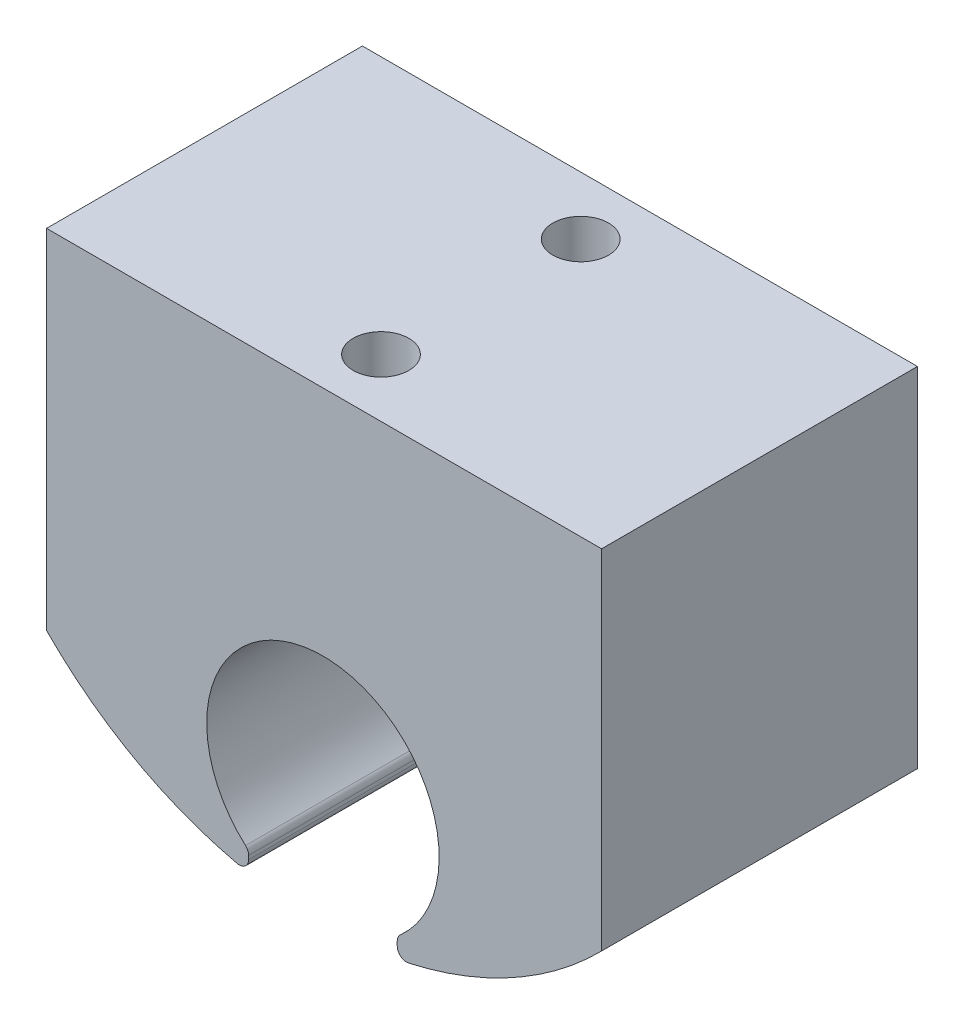
from build123d import *

# Parameters (mm, degrees)
BOSS_EXTRUDE1_START = -8.5
BOSS_EXTRUDE1_DEPTH = 17
CUT_EXTRUDE2_DEPTH  = 30.420443572
FILLET1_R           = 0.5
FILLET2_R           = 0.5
FILLET3_R           = 0.5
FILLET4_R           = 0.5
SKETCH3_R           = 1.5
CUT_EXTRUDE3_DEPTH  = 5


# Read off the part's stored shape, not the designer's step: Boss-Extrude1
with BuildPart() as part:
    # Boss-Extrude1 outline → Boss-Extrude1 (new body)
    with BuildSketch(Plane.XY.offset(BOSS_EXTRUDE1_START)):
        with BuildLine():
            ThreePointArc((-0.026346322, -6.254944514), (0.013173118, 6.254986128), (0, -6.255))
            ThreePointArc((0, -6.255), (8.130777353, -4.640165574), (15, 0))
            Line((15, 0), (15, 18.75))
            Line((15, 18.75), (-14.876085662, 18.75))
            Line((-14.876085662, 18.75), (-14.876085662, 0))
            ThreePointArc((-14.876085662, 0), (-8.076154016, -4.611125189), (-0.026346322, -6.254944514))
        make_face()
    extrude(amount=BOSS_EXTRUDE1_DEPTH)

    # Sketch2 → Cut-Extrude2 (cut, through all)
    with BuildSketch(Plane.XY.offset(8.5)):
        Polygon((4, 0), (0, 0), (-4, 0), (-4, -9.216790773), (4, -9.216790773), align=None)
    extrude(amount=-CUT_EXTRUDE2_DEPTH, mode=Mode.SUBTRACT)

    # Fillet1
    fillet1_edges = [part.edges().sort_by_distance(p)[0] for p in [
        (4, -4.808848585, 0),
    ]]
    fillet(fillet1_edges, radius=FILLET1_R)

    # Fillet2
    fillet2_edges = [part.edges().sort_by_distance(p)[0] for p in [
        (4, -5.881926017, 0),
    ]]
    fillet(fillet2_edges, radius=FILLET2_R)

    # Fillet3
    fillet3_edges = [part.edges().sort_by_distance(p)[0] for p in [
        (-4, -4.808848645, 0),
    ]]
    fillet(fillet3_edges, radius=FILLET3_R)

    # Fillet4
    fillet4_edges = [part.edges().sort_by_distance(p)[0] for p in [
        (-4, -5.857856611, 0),
    ]]
    fillet(fillet4_edges, radius=FILLET4_R)

    # Sketch3 → Cut-Extrude3 (cut)
    with BuildSketch(Plane(origin=(0, 18.75, 0), x_dir=(1, 0, 0), z_dir=(0, 1, 0))):
        with Locations(Location((0, -5.375, 0), (0, 0, 270))):
            Circle(SKETCH3_R)
        with Locations(Location((0, 5.375, 0), (0, 0, 270))):
            Circle(SKETCH3_R)
    extrude(amount=-CUT_EXTRUDE3_DEPTH, mode=Mode.SUBTRACT)


solid = part.part
